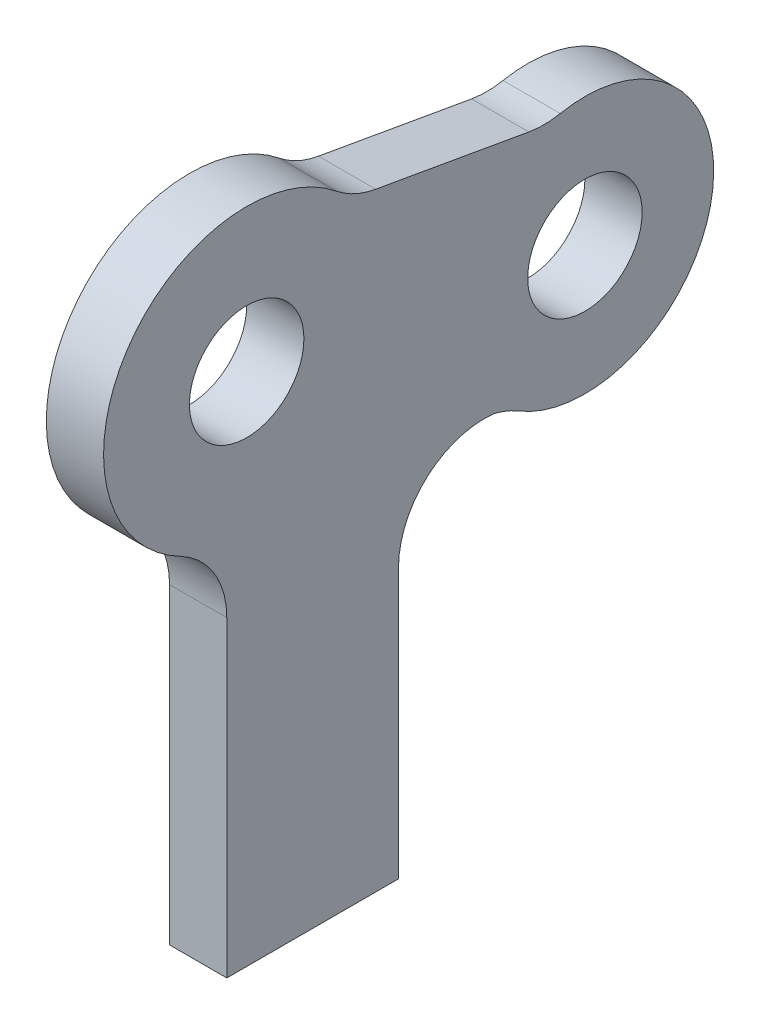
from build123d import *

# Parameters (mm, degrees)
EXTRUDE_1_DEPTH          = 2
CUT_EXTRUDE_3_DEPTH      = 25.377594344
CUT_EXTRUDE_3_DEPTH_BACK = 25.377594344
SKETCH_1_3_R             = 2
FILLET_1_R               = 3


with BuildPart() as part:
    # 草图1 → 凸台-拉伸1 (new body)
    with BuildSketch(Plane(origin=(0, 0, 0), x_dir=(0, 0, -1), z_dir=(1, 0, 0))):
        with BuildLine():
            Line((0.694592711, 3.939231012), (-0.694592711, -3.939231012))
            Line((-0.694592711, -3.939231012), (3.079360166, -3.939231012))
            ThreePointArc((3.079360166, -3.939231012), (4.494263056, -2.191255253), (5, 0))
            ThreePointArc((5, 0), (4.650004293, 1.837786733), (3.64901597, 3.418286479))
            Line((3.64901597, 3.418286479), (0.694592711, 3.939231012))
        make_face()
        with BuildLine():
            Line((2.259830548, -4.460175545), (-0.694592711, -3.939231012))
            Line((-0.694592711, -3.939231012), (-0.694592711, -4.951519056))
            ThreePointArc((-0.694592711, -4.951519056), (0.820272506, -4.932256382), (2.259830548, -4.460175545))
        make_face()
        with BuildLine():
            Line((3.079360166, -3.939231012), (-0.694592711, -3.939231012))
            Line((-0.694592711, -3.939231012), (2.259830548, -4.460175545))
            ThreePointArc((2.259830548, -4.460175545), (2.68227239, -4.219646292), (3.079360166, -3.939231012))
        make_face()
        with BuildLine():
            Line((-0.694592711, -4.951519056), (-0.694592711, -3.939231012))
            Line((-0.694592711, -3.939231012), (0.694592711, 3.939231012))
            Line((0.694592711, 3.939231012), (3.64901597, 3.418286479))
            ThreePointArc((3.64901597, 3.418286479), (-4.437968609, 2.303135825), (-0.694592711, -4.951519056))
        make_face()
        with BuildLine():
            ThreePointArc((5, 0), (4.494263056, -2.191255253), (3.079360166, -3.939231012))
            Line((3.079360166, -3.939231012), (5.305407289, -3.939231012))
            Line((5.305407289, -3.939231012), (5.305407289, -4.997192896))
            Line((5.305407289, -4.997192896), (9.092867132, -5.665024255))
            ThreePointArc((9.092867132, -5.665024255), (7.386058148, -1.302361333), (10.482052554, 2.213437769))
            Line((10.482052554, 2.213437769), (3.64901597, 3.418286479))
            ThreePointArc((3.64901597, 3.418286479), (4.650004293, 1.837786733), (5, 0))
        make_face()
        with BuildLine():
            Line((5.305407289, -3.939231012), (3.079360166, -3.939231012))
            ThreePointArc((3.079360166, -3.939231012), (2.68227239, -4.219646292), (2.259830548, -4.460175545))
            Line((2.259830548, -4.460175545), (5.305407289, -4.997192896))
            Line((5.305407289, -4.997192896), (5.305407289, -3.939231012))
        make_face()
        with BuildLine():
            ThreePointArc((2.259830548, -4.460175545), (0.820272506, -4.932256382), (-0.694592711, -4.951519056))
            Line((-0.694592711, -4.951519056), (-0.694592711, -18))
            Line((-0.694592711, -18), (5.305407289, -18))
            Line((5.305407289, -18), (5.305407289, -4.997192896))
            Line((5.305407289, -4.997192896), (2.259830548, -4.460175545))
        make_face()
        with BuildLine():
            ThreePointArc((16.317693036, -2.083778132), (14.485990042, 1.539782422), (10.482052554, 2.213437769))
            Line((10.482052554, 2.213437769), (12.512285747, 1.85545288))
            Line((12.512285747, 1.85545288), (11.123100325, -6.023009144))
            Line((11.123100325, -6.023009144), (9.092867132, -5.665024255))
            ThreePointArc((9.092867132, -5.665024255), (13.816227929, -6.115633571), (16.317693036, -2.083778132))
        make_face()
        with BuildLine():
            Line((12.512285747, 1.85545288), (10.482052554, 2.213437769))
            ThreePointArc((10.482052554, 2.213437769), (7.386058148, -1.302361333), (9.092867132, -5.665024255))
            Line((9.092867132, -5.665024255), (11.123100325, -6.023009144))
            Line((11.123100325, -6.023009144), (12.512285747, 1.85545288))
        make_face()
    extrude(amount=EXTRUDE_1_DEPTH)

    # 草图1<3> → 切除-拉伸3 (cut, two sides: drawn at the far end of the back side and taken through both)
    with BuildSketch(Plane(origin=(0, 0, 0), x_dir=(0, 0, -1), z_dir=(1, 0, 0)).offset(-CUT_EXTRUDE_3_DEPTH_BACK)):
        Circle(SKETCH_1_3_R)
        with Locations((11.817693036, -2.083778132)):
            Circle(SKETCH_1_3_R)
    extrude(amount=CUT_EXTRUDE_3_DEPTH + CUT_EXTRUDE_3_DEPTH_BACK, mode=Mode.SUBTRACT)

    # 圆角1
    # the kernel refuses this fillet: 3 mm, written as the material it adds along each edge
    with BuildSketch(Plane(origin=(0, -4.951519056, 0.694592711), x_dir=(0, -1, 0), z_dir=(1, 0, 0))) as fillet_1_piece_1:
        with BuildLine():
            CenterArc((2.144253255, -3), FILLET_1_R, 90, 62.495124604)
            ThreePointArc((-0.516661362, -1.614527733), (-0.189409011, -0.829319334), (0, 0))
            Line((0, 0), (2.144253255, 0))
        make_face()
    extrude(amount=2)
    with BuildSketch(Plane(origin=(0, 3.418286479, -3.64901597), x_dir=(0, -0.17364817766699442, -0.9848077530121968), z_dir=(1, 0, 0))) as fillet_1_piece_2:
        with BuildLine():
            CenterArc((0.872983346, 3), FILLET_1_R, 241.044975628, 28.955024372)
            ThreePointArc((-0.579385409, 0.375), (-0.283214788, 0.19750856), (0, 0))
            Line((0, 0), (0.872983346, 0))
        make_face()
    extrude(amount=2)
    with BuildSketch(Plane(origin=(0, -4.997192896, -5.305407289), x_dir=(0, -0.17364817766692767, -0.9848077530122085), z_dir=(1, 0, 0))) as fillet_1_piece_3:
        with BuildLine():
            CenterArc((FILLET_1_R * 1.19175359259, -FILLET_1_R), FILLET_1_R, 90, 100)
            Line((FILLET_1_R * 0.206945839582, -FILLET_1_R * 1.17364817767), (0, 0))
            Line((0, 0), (FILLET_1_R * 1.19175359259, 0))
        make_face()
    extrude(amount=2)
    with BuildSketch(Plane(origin=(0, -5.665024255, -9.092867132), x_dir=(0, 0.17364817766698767, 0.9848077530121979), z_dir=(1, 0, 0))) as fillet_1_piece_4:
        with BuildLine():
            CenterArc((0.631029591, 3), FILLET_1_R, 248.960530219, 21.039469781)
            ThreePointArc((-0.446003371, 0.2), (-0.220284161, 0.106060125), (0, 0))
            Line((0, 0), (0.631029591, 0))
        make_face()
    extrude(amount=2)
    with BuildSketch(Plane(origin=(0, 2.213437769, -10.482052554), x_dir=(0, 0.2445079523565027, -0.9696472870247357), z_dir=(1, 0, 0))) as fillet_1_piece_5:
        with BuildLine():
            CenterArc((0.651724559, 2.995572307), FILLET_1_R, 245.847242884, 21.039469781)
            Line((-0.575787876, 0.25819889), (0, 0))
            ThreePointArc((0, 0), (0.24439671, 0.00664154), (0.488793419, 0))
        make_face()
    extrude(amount=2)


solid = part.part
